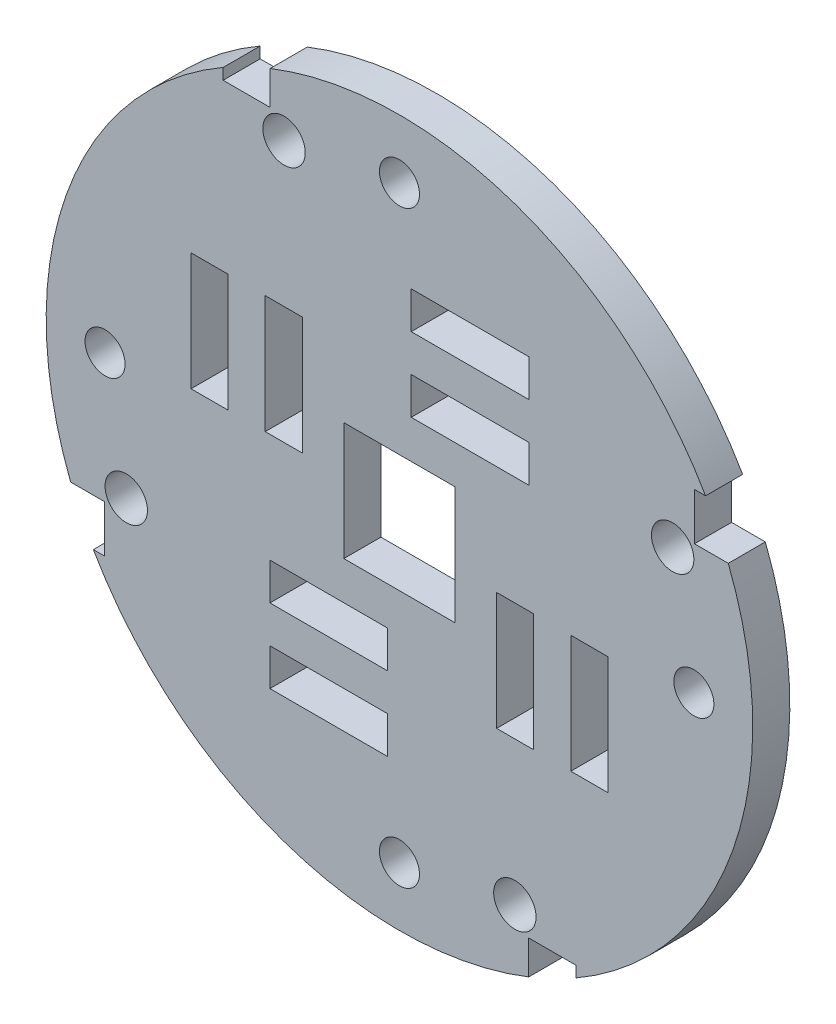
from build123d import *

# Parameters (mm, degrees)
SKETCH1_R           = 38.1
BOSS_EXTRUDE1_DEPTH = 4
SKETCH2_R           = 2.286
SKETCH2_W           = 12.7
SKETCH2_H           = 4
SKETCH2_W_2         = 4
SKETCH2_H_2         = 12.7
CUT_EXTRUDE1_DEPTH  = 55.029806589
CUT_EXTRUDE2_REACH  = 56.03
SKETCH3_W           = 12
SKETCH3_H           = 12.7
SKETCH4_R           = 2.159
CUT_EXTRUDE3_DEPTH  = 55.029806589
CUT_EXTRUDE4_REACH  = 56.03
SKETCH5_W           = 5.08
SKETCH5_H           = 5.08


with BuildPart() as part:
    # Sketch1 → Boss-Extrude1 (new body)
    with BuildSketch(Plane.XY):
        Circle(SKETCH1_R)
    extrude(amount=BOSS_EXTRUDE1_DEPTH)

    # Sketch2 → Cut-Extrude1 (cut, through all)
    with BuildSketch(Plane.XY.offset(4)):
        with Locations((12.446, -29.464)):
            Circle(SKETCH2_R)
        with Locations((-29.464, -12.446)):
            Circle(SKETCH2_R)
        with Locations((-12.446, 29.464)):
            Circle(SKETCH2_R)
        with Locations((29.464, 12.446)):
            Circle(SKETCH2_R)
        with Locations((-7.62, -12.478)):
            Rectangle(SKETCH2_W, SKETCH2_H)
        with Locations((12.478, -7.62)):
            Rectangle(SKETCH2_W_2, SKETCH2_H_2)
        with Locations((20.478, -7.62)):
            Rectangle(SKETCH2_W_2, SKETCH2_H_2)
        with Locations((-7.62, -20.478)):
            Rectangle(SKETCH2_W, SKETCH2_H)
        with Locations((-12.478, 7.62)):
            Rectangle(SKETCH2_W_2, SKETCH2_H_2)
        with Locations((-20.478, 7.62)):
            Rectangle(SKETCH2_W_2, SKETCH2_H_2)
        with Locations((7.62, 12.478)):
            Rectangle(SKETCH2_W, SKETCH2_H)
        with Locations((7.62, 20.478)):
            Rectangle(SKETCH2_W, SKETCH2_H)
    extrude(amount=-CUT_EXTRUDE1_DEPTH, mode=Mode.SUBTRACT)

    # Sketch3 → Cut-Extrude2 (cut, up to next)
    with BuildSketch(Plane.XY.offset(4), mode=Mode.PRIVATE) as cut_extrude2_sk1:
        Rectangle(SKETCH3_W, SKETCH3_H)
    cut_extrude2_tool1 = extrude(cut_extrude2_sk1.sketch, amount=-CUT_EXTRUDE2_REACH, mode=Mode.PRIVATE) & part.part
    add(cut_extrude2_tool1.solids().sort_by_distance((0, 0, 4))[0], mode=Mode.SUBTRACT)

    # Sketch4 → Cut-Extrude3 (cut, through all)
    with BuildSketch(Plane.XY.offset(4)):
        with Locations((0, -31.75)):
            Circle(SKETCH4_R)
        with Locations((31.75, 0)):
            Circle(SKETCH4_R)
        with Locations((0, 31.75)):
            Circle(SKETCH4_R)
        with Locations((-31.75, 0)):
            Circle(SKETCH4_R)
    extrude(amount=-CUT_EXTRUDE3_DEPTH, mode=Mode.SUBTRACT)

    # Sketch5 → Cut-Extrude4 (cut, up to next)
    with BuildSketch(Plane.XY.offset(4), mode=Mode.PRIVATE) as cut_extrude4_sk1:
        with Locations((34.352372786, 16.478)):
            Rectangle(SKETCH5_W, SKETCH5_H)
    cut_extrude4_tool1 = extrude(cut_extrude4_sk1.sketch, amount=-CUT_EXTRUDE4_REACH, mode=Mode.PRIVATE) & part.part
    # Sketch5 → Cut-Extrude4 (cut, up to next)
    with BuildSketch(Plane.XY.offset(4), mode=Mode.PRIVATE) as cut_extrude4_sk2:
        with Locations((16.478, -34.352372786)):
            Rectangle(SKETCH5_W, SKETCH5_H)
    cut_extrude4_tool2 = extrude(cut_extrude4_sk2.sketch, amount=-CUT_EXTRUDE4_REACH, mode=Mode.PRIVATE) & part.part
    # Sketch5 → Cut-Extrude4 (cut, up to next)
    with BuildSketch(Plane.XY.offset(4), mode=Mode.PRIVATE) as cut_extrude4_sk3:
        with Locations((-34.352372786, -16.478)):
            Rectangle(SKETCH5_W, SKETCH5_H)
    cut_extrude4_tool3 = extrude(cut_extrude4_sk3.sketch, amount=-CUT_EXTRUDE4_REACH, mode=Mode.PRIVATE) & part.part
    # Sketch5 → Cut-Extrude4 (cut, up to next)
    with BuildSketch(Plane.XY.offset(4), mode=Mode.PRIVATE) as cut_extrude4_sk4:
        with Locations((-16.478, 34.352372786)):
            Rectangle(SKETCH5_W, SKETCH5_H)
    cut_extrude4_tool4 = extrude(cut_extrude4_sk4.sketch, amount=-CUT_EXTRUDE4_REACH, mode=Mode.PRIVATE) & part.part
    add(cut_extrude4_tool1.solids().sort_by_distance((34.352373, 16.478, 4))[0], mode=Mode.SUBTRACT)
    add(cut_extrude4_tool2.solids().sort_by_distance((16.478, -34.352373, 4))[0], mode=Mode.SUBTRACT)
    add(cut_extrude4_tool3.solids().sort_by_distance((-34.352373, -16.478, 4))[0], mode=Mode.SUBTRACT)
    add(cut_extrude4_tool4.solids().sort_by_distance((-16.478, 34.352373, 4))[0], mode=Mode.SUBTRACT)


solid = part.part
